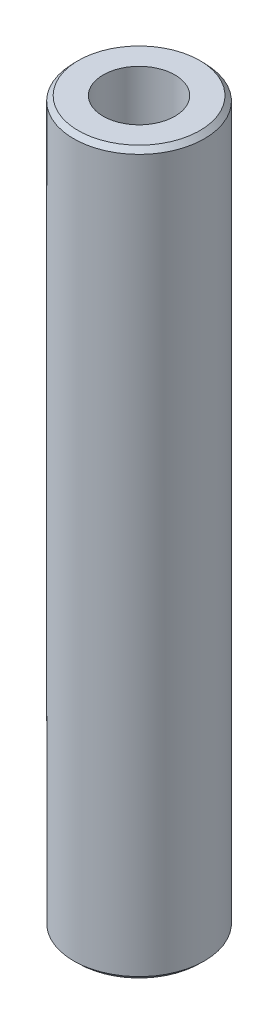
from build123d import *
from OCP.BRepFilletAPI import BRepFilletAPI_MakeChamfer

# Parameters (mm, degrees)
SKETCH1_R           = 40
BOSS_EXTRUDE1_DEPTH = 441.541938824
SKETCH2_R           = 21.950113323
CUT_EXTRUDE1_DEPTH  = 446.150855037
CHAMFER1_SIZE       = 2.905349104
CHAMFER1_SIZE2      = 2.80668191


with BuildPart() as part:
    # Sketch1 → Boss-Extrude1 (new body)
    with BuildSketch(Plane(origin=(0, 0, 0), x_dir=(1, 0, 0), z_dir=(0, 1, 0))):
        Circle(SKETCH1_R)
    extrude(amount=BOSS_EXTRUDE1_DEPTH)

    # Sketch2 → Cut-Extrude1 (cut, through all)
    with BuildSketch(Plane(origin=(0, 0, 0), x_dir=(1, 0, 0), z_dir=(0, 1, 0))):
        Circle(SKETCH2_R)
    extrude(amount=CUT_EXTRUDE1_DEPTH, mode=Mode.SUBTRACT)

    # Chamfer1: one chamfer whose edges measure the first distance from different faces: ONE call of the kernel's chamfer builder (chamfer() names one face for all edges)
    chamfer1_edges_1 = [part.edges().sort_by_distance(p)[0] for p in [
        (-40, 441.541938824, 0),
    ]]
    chamfer1_side_1 = [part.faces().sort_by_distance(p)[0] for p in [
        (-40, 220.770969412, 0),
    ]]
    chamfer1_edges_2 = [part.edges().sort_by_distance(p)[0] for p in [
        (-40, 0, 0),
    ]]
    chamfer1_side_2 = [part.faces().sort_by_distance(p)[0] for p in [
        (-38.86862915, 0, 0),
    ]]
    chamfer1 = BRepFilletAPI_MakeChamfer(part.part.solid().wrapped)
    for e in chamfer1_edges_1:
        chamfer1.Add(CHAMFER1_SIZE, CHAMFER1_SIZE2, e.wrapped, chamfer1_side_1[0].wrapped)  # the first distance lies on this face
    for e in chamfer1_edges_2:
        chamfer1.Add(CHAMFER1_SIZE, CHAMFER1_SIZE2, e.wrapped, chamfer1_side_2[0].wrapped)  # the first distance lies on this face
    add(Compound.cast(chamfer1.Shape()), mode=Mode.REPLACE)


solid = part.part
